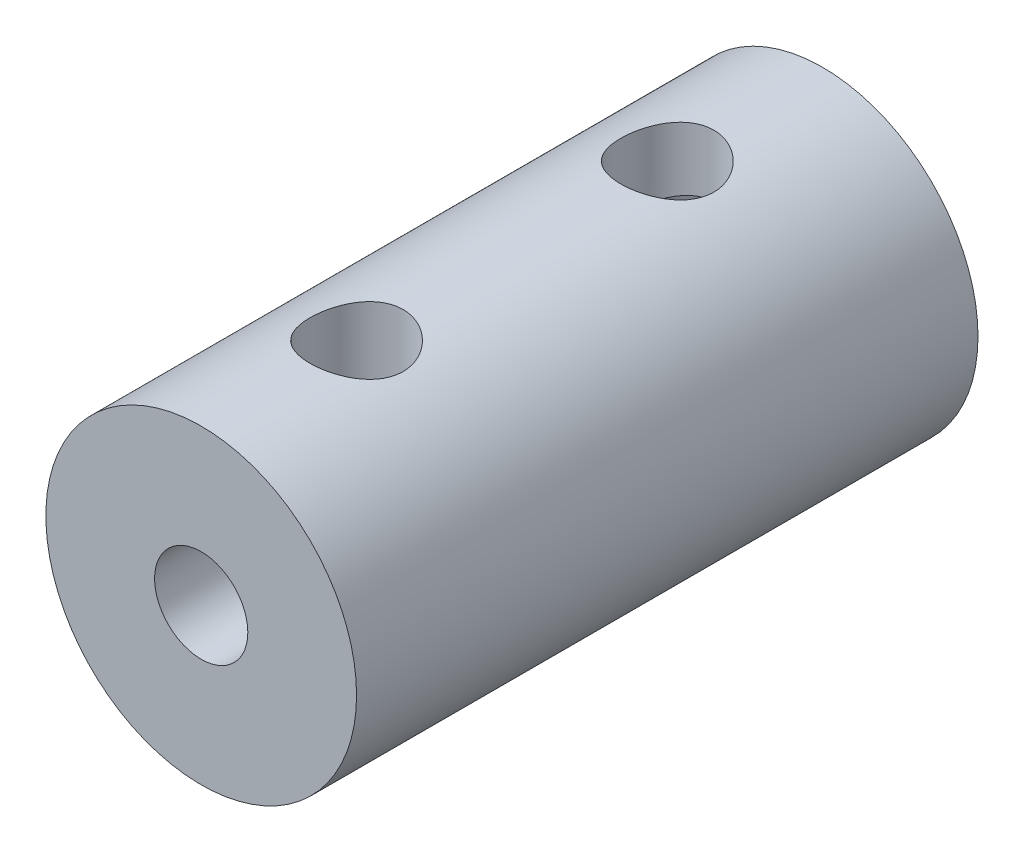
from build123d import *

# Parameters (mm, degrees)
SKETCH1_R           = 5
SKETCH1_R_2         = 3
BOSS_EXTRUDE1_DEPTH = 10
SKETCH2_R           = 5
SKETCH2_R_2         = 1.5
BOSS_EXTRUDE2_DEPTH = 10
SKETCH3_R           = 1.5
CUT_EXTRUDE1_DEPTH  = 10


with BuildPart() as part:
    # Sketch1 → Boss-Extrude1 (new body)
    with BuildSketch(Plane.XY):
        Circle(SKETCH1_R)
        Circle(SKETCH1_R_2, mode=Mode.SUBTRACT)
    extrude(amount=BOSS_EXTRUDE1_DEPTH)

    # Sketch2 → Boss-Extrude2 (add)
    with BuildSketch(Plane.XY.offset(10)):
        Circle(SKETCH2_R)
        Circle(SKETCH2_R_2, mode=Mode.SUBTRACT)
    extrude(amount=BOSS_EXTRUDE2_DEPTH)

    # Sketch3 → Cut-Extrude1 (cut)
    with BuildSketch(Plane(origin=(0, 0, 0), x_dir=(1, 0, 0), z_dir=(0, 1, 0))):
        with Locations((0, -5)):
            Circle(SKETCH3_R)
        with Locations((0, -15)):
            Circle(SKETCH3_R)
    extrude(amount=CUT_EXTRUDE1_DEPTH, mode=Mode.SUBTRACT)


solid = part.part
